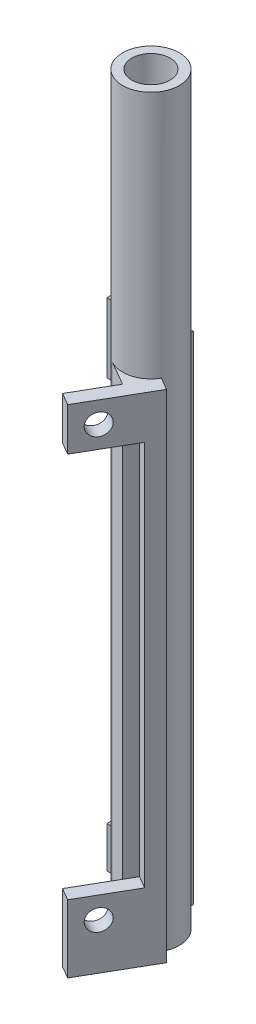
from build123d import *

# Parameters (mm, degrees)
SKETCH1_R           = 5.08
BOSS_EXTRUDE1_DEPTH = 133.35
SKETCH2_R           = 3.429
CUT_EXTRUDE1_DEPTH  = 134.543383588
BOSS_EXTRUDE2_DEPTH = 88.9
HOLE_CUTS_1_REACH   = 136.721
SKETCH4_R           = 1.905
HOLE_CUTS_2_REACH   = 136.721
SKETCH7_R           = 1.905
CUT_EXTRUDE7_REACH  = 136.721
SKETCH8_W           = 6.604
SKETCH8_H           = 4.572
SKETCH9_W           = 11.684
SKETCH9_H           = 88.9
CUT_EXTRUDE8_DEPTH  = 2.54
SKETCH10_W          = 11.684
SKETCH10_H          = 88.9
CUT_EXTRUDE9_DEPTH  = 2.54
SKETCH11_W          = 6.604
SKETCH11_H          = 88.9
CUT_EXTRUDE10_DEPTH = 0.508
SKETCH13_W          = 6.604
SKETCH13_H          = 88.9
CUT_EXTRUDE11_DEPTH = 0.508
SKETCH14_W          = 2.54
SKETCH14_H          = 88.9
BOSS_EXTRUDE3_DEPTH = 1.27
SKETCH15_W          = 2.54
SKETCH15_H          = 88.9
BOSS_EXTRUDE4_DEPTH = 1.27
SKETCH20_W          = 10.0965
SKETCH20_H          = 69.088
CUT_EXTRUDE13_DEPTH = 2.54
SKETCH21_W          = 10.0965
SKETCH21_H          = 69.088
CUT_EXTRUDE14_DEPTH = 2.54


with BuildPart() as part:
    # Sketch1 → Boss-Extrude1 (new body)
    with BuildSketch(Plane(origin=(0, 0, 0), x_dir=(1, 0, 0), z_dir=(0, 1, 0))):
        Circle(SKETCH1_R)
    extrude(amount=BOSS_EXTRUDE1_DEPTH)

    # Sketch2 → Cut-Extrude1 (cut, through all)
    with BuildSketch(Plane.XZ):
        Circle(SKETCH2_R)
    extrude(amount=-CUT_EXTRUDE1_DEPTH, mode=Mode.SUBTRACT)

    # Sketch3 → Boss-Extrude2 (add)
    with BuildSketch(Plane.XZ):
        with BuildLine():
            Line((-1.442590949, 12.658640818), (-5.842, 10.118640818))
            Line((-5.842, 10.118640818), (-2.54, 4.399409051))
            ThreePointArc((-2.54, 4.399409051), (2.96960111, -1.7145), (-5.08, 0))
            Line((-5.08, 0), (-11.684, 0))
            Line((-11.684, 0), (-11.684, -5.08))
            Line((-11.684, -5.08), (-11.684, -10.16))
            Line((-11.684, -10.16), (0, -10.16))
            Line((0, -10.16), (0, -5.08))
            ThreePointArc((0, -5.08), (4.399409051, -2.54), (4.399409051, 2.54))
            Line((4.399409051, 2.54), (8.798818102, 5.08))
            Line((8.798818102, 5.08), (2.956818102, 15.198640818))
            Line((2.956818102, 15.198640818), (-1.442590949, 12.658640818))
        make_face()
    extrude(amount=-BOSS_EXTRUDE2_DEPTH)

    # Sketch4 → Hole Cuts 1 (cut, up to next)
    with BuildSketch(Plane.XY, mode=Mode.PRIVATE) as hole_cuts_1_sk1:
        with Locations((-8.89, 80.01)):
            Circle(SKETCH4_R)
    hole_cuts_1_tool1 = extrude(hole_cuts_1_sk1.sketch, amount=-HOLE_CUTS_1_REACH, mode=Mode.PRIVATE) & part.part
    # Sketch4 → Hole Cuts 1 (cut, up to next)
    with BuildSketch(Plane.XY, mode=Mode.PRIVATE) as hole_cuts_1_sk2:
        with Locations((-8.89, 3.81)):
            Circle(SKETCH4_R)
    hole_cuts_1_tool2 = extrude(hole_cuts_1_sk2.sketch, amount=-HOLE_CUTS_1_REACH, mode=Mode.PRIVATE) & part.part
    add(hole_cuts_1_tool1.solids().sort_by_distance((-8.89, 80.01, 0))[0], mode=Mode.SUBTRACT)
    add(hole_cuts_1_tool2.solids().sort_by_distance((-8.89, 3.81, 0))[0], mode=Mode.SUBTRACT)

    # Sketch7 → Hole Cuts 2 (cut, up to next)
    with BuildSketch(Plane(origin=(0, 0, 0), x_dir=(0.49999999999999784, 0, -0.86602540378444), z_dir=(0.86602540378444, 0, 0.49999999999999784)), mode=Mode.PRIVATE) as hole_cuts_2_sk1:
        with Locations((-8.89, 85.09)):
            Circle(SKETCH7_R)
    hole_cuts_2_tool1 = extrude(hole_cuts_2_sk1.sketch, amount=HOLE_CUTS_2_REACH, mode=Mode.PRIVATE) & part.part
    # Sketch7 → Hole Cuts 2 (cut, up to next)
    with BuildSketch(Plane(origin=(0, 0, 0), x_dir=(0.49999999999999784, 0, -0.86602540378444), z_dir=(0.86602540378444, 0, 0.49999999999999784)), mode=Mode.PRIVATE) as hole_cuts_2_sk2:
        with Locations((-8.89, 8.255)):
            Circle(SKETCH7_R)
    hole_cuts_2_tool2 = extrude(hole_cuts_2_sk2.sketch, amount=HOLE_CUTS_2_REACH, mode=Mode.PRIVATE) & part.part
    add(hole_cuts_2_tool1.solids().sort_by_distance((-4.445, 85.09, 7.698966))[0], mode=Mode.SUBTRACT)
    add(hole_cuts_2_tool2.solids().sort_by_distance((-4.445, 8.255, 7.698966))[0], mode=Mode.SUBTRACT)

    # Sketch8 → Cut-Extrude7 (cut, up to next)
    with BuildSketch(Plane.XZ, mode=Mode.PRIVATE) as cut_extrude7_sk1:
        Polygon((-5.842, 10.118640818), (-1.882531854, 12.404640818), (1.419468146, 6.685409051), (-2.54, 4.399409051), align=None)
    cut_extrude7_tool1 = extrude(cut_extrude7_sk1.sketch, amount=-CUT_EXTRUDE7_REACH, mode=Mode.PRIVATE) & part.part
    # Sketch8 → Cut-Extrude7 (cut, up to next)
    with BuildSketch(Plane.XZ, mode=Mode.PRIVATE) as cut_extrude7_sk2:
        with Locations((-8.382, -2.286)):
            Rectangle(SKETCH8_W, SKETCH8_H)
    cut_extrude7_tool2 = extrude(cut_extrude7_sk2.sketch, amount=-CUT_EXTRUDE7_REACH, mode=Mode.PRIVATE) & part.part
    add(cut_extrude7_tool1.solids().sort_by_distance((-2.211266, 0, 8.402025))[0], mode=Mode.SUBTRACT)
    add(cut_extrude7_tool2.solids().sort_by_distance((-8.382, 0, -2.286))[0], mode=Mode.SUBTRACT)

    # Sketch9 → Cut-Extrude8 (cut)
    with BuildSketch(Plane(origin=(0, 0, -10.16), x_dir=(-1, 0, 0), z_dir=(0, 0, -1))):
        with Locations((5.842, 44.45)):
            Rectangle(SKETCH9_W, SKETCH9_H)
    extrude(amount=-CUT_EXTRUDE8_DEPTH, mode=Mode.SUBTRACT)

    # Sketch10 → Cut-Extrude9 (cut)
    with BuildSketch(Plane(origin=(8.798818102, 0, 5.08), x_dir=(0.4999999999999982, 0, -0.8660254037844397), z_dir=(0.8660254037844398, 0, 0.4999999999999983))):
        with Locations((-5.842, 44.45)):
            Rectangle(SKETCH10_W, SKETCH10_H)
    extrude(amount=-CUT_EXTRUDE9_DEPTH, mode=Mode.SUBTRACT)

    # Sketch11 → Cut-Extrude10 (cut)
    with BuildSketch(Plane.XY.offset(-4.572)):
        with Locations((-8.382, 44.45)):
            Rectangle(SKETCH11_W, SKETCH11_H)
    extrude(amount=-CUT_EXTRUDE10_DEPTH, mode=Mode.SUBTRACT)

    # Sketch13 → Cut-Extrude11 (cut)
    with BuildSketch(Plane(origin=(3.959468146, 0, 2.286), x_dir=(-0.5000000000000004, 0, 0.8660254037844384), z_dir=(-0.8660254037844384, 0, -0.5000000000000004))):
        with Locations((8.382, 44.45)):
            Rectangle(SKETCH13_W, SKETCH13_H)
    extrude(amount=-CUT_EXTRUDE11_DEPTH, mode=Mode.SUBTRACT)

    # Sketch14 → Boss-Extrude3 (add)
    with BuildSketch(Plane(origin=(-5.842, 0, 10.118640818), x_dir=(0.8660254037844394, 0, 0.4999999999999989), z_dir=(-0.4999999999999989, 0, 0.8660254037844394))):
        with Locations((6.35, 44.45)):
            Rectangle(SKETCH14_W, SKETCH14_H)
    extrude(amount=BOSS_EXTRUDE3_DEPTH)

    # Sketch15 → Boss-Extrude4 (add)
    with BuildSketch(Plane.ZY.offset(11.684)):
        with Locations((-6.35, 44.45)):
            Rectangle(SKETCH15_W, SKETCH15_H)
    extrude(amount=BOSS_EXTRUDE4_DEPTH)

    # Sketch20 → Cut-Extrude13 (cut)
    with BuildSketch(Plane.XY.offset(-5.08)):
        with Locations((-7.90575, 41.91)):
            Rectangle(SKETCH20_W, SKETCH20_H)
    extrude(amount=-CUT_EXTRUDE13_DEPTH, mode=Mode.SUBTRACT)

    # Sketch21 → Cut-Extrude14 (cut)
    with BuildSketch(Plane(origin=(6.599113577, 0, 3.81), x_dir=(0.4999999999999983, 0, -0.8660254037844397), z_dir=(0.8660254037844396, 0, 0.4999999999999982))):
        with Locations((-7.90575, 46.6725)):
            Rectangle(SKETCH21_W, SKETCH21_H)
    extrude(amount=-CUT_EXTRUDE14_DEPTH, mode=Mode.SUBTRACT)


solid = part.part
